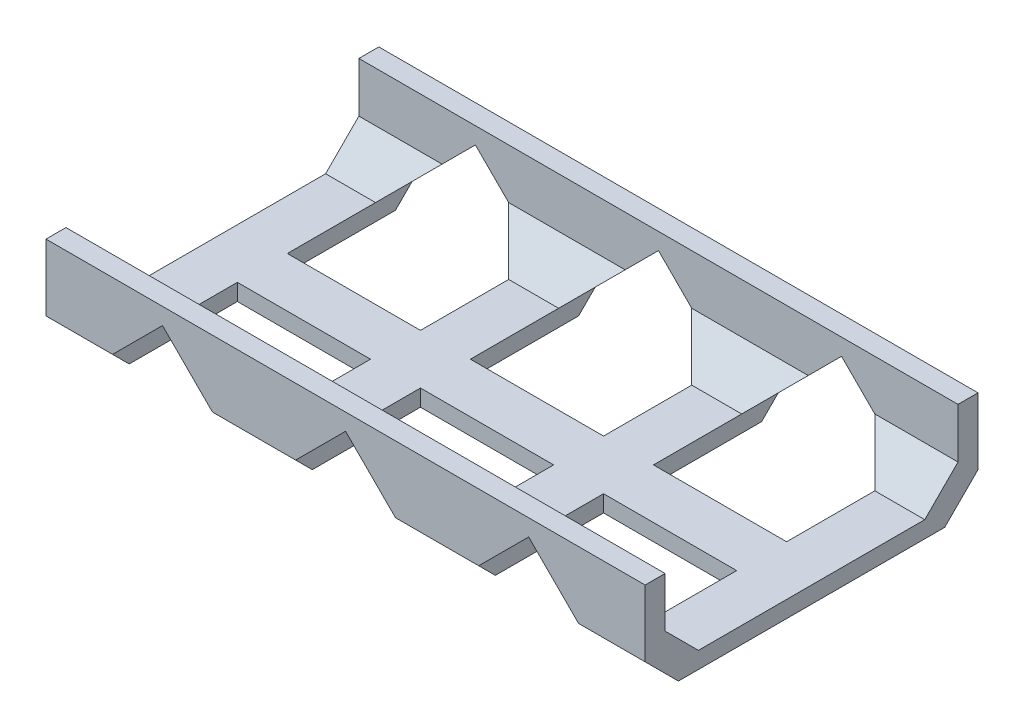
from build123d import *

# Parameters (mm, degrees)
SKETCH1_W           = 114.3
SKETCH1_H           = 9.525
BOSS_EXTRUDE1_DEPTH = 3.175
SKETCH2_W           = 9.525
SKETCH2_H           = 63.5
BOSS_EXTRUDE2_DEPTH = 3.175
SKETCH3_W           = 9.525
SKETCH3_H           = 3.81
BOSS_EXTRUDE3_DEPTH = 12.7
SKETCH4_W           = 114.3
SKETCH4_H           = 3.81
BOSS_EXTRUDE4_DEPTH = 3.175
CHAMFER1_SIZE       = 12.7
CHAMFER2_SIZE       = 6.35


with BuildPart() as part:
    # Sketch1 → Boss-Extrude1 (new body)
    with BuildSketch(Plane(origin=(0, 0, 0), x_dir=(1, 0, 0), z_dir=(0, 1, 0))):
        Rectangle(SKETCH1_W, SKETCH1_H)
    extrude(amount=BOSS_EXTRUDE1_DEPTH)

    # Sketch2 → Boss-Extrude2 (add)
    with BuildSketch(Plane(origin=(0, 3.175, 0), x_dir=(1, 0, 0), z_dir=(0, 1, 0))):
        with Locations((-52.3875, 0)):
            Rectangle(SKETCH2_W, SKETCH2_H)
        with Locations((52.3875, 0)):
            Rectangle(SKETCH2_W, SKETCH2_H)
        with Locations((17.4625, 0)):
            Rectangle(SKETCH2_W, SKETCH2_H)
        with Locations((-17.4625, 0)):
            Rectangle(SKETCH2_W, SKETCH2_H)
    extrude(amount=-BOSS_EXTRUDE2_DEPTH)

    # Sketch3 → Boss-Extrude3 (add)
    with BuildSketch(Plane(origin=(0, 3.175, 0), x_dir=(1, 0, 0), z_dir=(0, 1, 0))):
        with Locations((-52.3875, -29.845)):
            Rectangle(SKETCH3_W, SKETCH3_H)
        with Locations((-17.4625, -29.845)):
            Rectangle(SKETCH3_W, SKETCH3_H)
        with Locations((17.4625, -29.845)):
            Rectangle(SKETCH3_W, SKETCH3_H)
        with Locations((52.3875, -29.845)):
            Rectangle(SKETCH3_W, SKETCH3_H)
        with Locations((52.3875, 29.845)):
            Rectangle(SKETCH3_W, SKETCH3_H)
        with Locations((17.4625, 29.845)):
            Rectangle(SKETCH3_W, SKETCH3_H)
        with Locations((-17.4625, 29.845)):
            Rectangle(SKETCH3_W, SKETCH3_H)
        with Locations((-52.3875, 29.845)):
            Rectangle(SKETCH3_W, SKETCH3_H)
    extrude(amount=BOSS_EXTRUDE3_DEPTH)

    # Sketch4 → Boss-Extrude4 (add)
    with BuildSketch(Plane(origin=(0, 15.875, 0), x_dir=(1, 0, 0), z_dir=(0, 1, 0))):
        with Locations((0, -29.845)):
            Rectangle(SKETCH4_W, SKETCH4_H)
        with Locations((0, 29.845)):
            Rectangle(SKETCH4_W, SKETCH4_H)
    extrude(amount=BOSS_EXTRUDE4_DEPTH)

    # Chamfer1
    chamfer1_edges = [part.edges().sort_by_distance(p)[0] for p in [
        (47.625, 15.875, -29.845),
        (22.225, 15.875, -29.845),
        (12.7, 15.875, -29.845),
        (-12.7, 15.875, -29.845),
        (-22.225, 15.875, -29.845),
        (-47.625, 15.875, -29.845),
        (47.625, 15.875, 29.845),
        (22.225, 15.875, 29.845),
        (12.7, 15.875, 29.845),
        (-12.7, 15.875, 29.845),
        (-22.225, 15.875, 29.845),
        (-47.625, 15.875, 29.845),
    ]]
    chamfer(chamfer1_edges, length=CHAMFER1_SIZE - 0.0001)  # a hair under: the kernel refuses the full size

    # Chamfer2
    chamfer2_edges = [part.edges().sort_by_distance(p)[0] for p in [
        (-52.3875, 3.175, -27.94),
        (-17.4625, 3.175, -27.94),
        (17.4625, 3.175, -27.94),
        (52.3875, 3.175, -27.94),
        (52.3875, 3.175, 27.94),
        (17.4625, 3.175, 27.94),
        (-17.4625, 3.175, 27.94),
        (-52.3875, 3.175, 27.94),
    ]]
    chamfer(chamfer2_edges, length=CHAMFER2_SIZE)
    chamfer2_2_edges = [part.edges().sort_by_distance(p)[0] for p in [
        (-52.3875, 0, -31.75),
        (-17.4625, 0, -31.75),
        (17.4625, 0, -31.75),
        (52.3875, 0, -31.75),
        (52.3875, 0, 31.75),
        (17.4625, 0, 31.75),
        (-17.4625, 0, 31.75),
        (-52.3875, 0, 31.75),
    ]]
    chamfer(chamfer2_2_edges, length=CHAMFER2_SIZE)


solid = part.part
